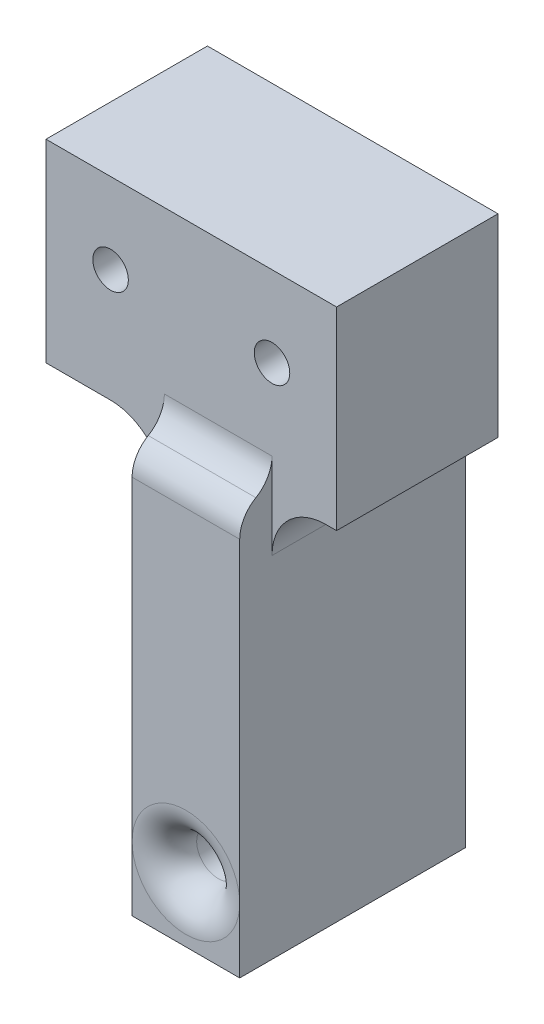
from build123d import *

# Parameters (mm, degrees)
SKETCH_2_R               = 1.65
EXTRUDE_1_DEPTH          = 15
SKETCH_4_W               = 10
SKETCH_4_H               = 21
EXTRUDE_2_DEPTH          = 37.5
CUT_EXTRUDE_1_DEPTH      = 54.011791141
CUT_EXTRUDE_1_DEPTH_BACK = 54.011791141
SKETCH_5_R               = 2
FILLET_1_R               = 3
FILLET_2_R               = 3
FILLET_3_R               = 5


with BuildPart() as part:
    # 草图2 → 凸台-拉伸1 (new body)
    with BuildSketch(Plane.XY):
        Polygon((-13.5, -7.5), (-13.5, 7.5), (13.5, 7.5), (13.5, -7.5), (13.5, -10.5), (-13.5, -10.5), align=None)
        with Locations((7.5, 0)):
            Circle(SKETCH_2_R, mode=Mode.SUBTRACT)
        with Locations((-7.5, 0)):
            Circle(SKETCH_2_R, mode=Mode.SUBTRACT)
    extrude(amount=EXTRUDE_1_DEPTH)

    # 草图4 → 凸台-拉伸2 (add)
    with BuildSketch(Plane.XZ.offset(10.5)):
        with Locations((2.5, 7.5)):
            Rectangle(SKETCH_4_W, SKETCH_4_H)
    extrude(amount=EXTRUDE_2_DEPTH)

    # 草图5 → 切除-拉伸1 (cut, two sides: drawn at the far end of the back side and taken through both)
    with BuildSketch(Plane(origin=(0, 0, 0), x_dir=(-1, 0, 0), z_dir=(0, 0, -1)).offset(-CUT_EXTRUDE_1_DEPTH_BACK)):
        with Locations((-2.5, -42)):
            Circle(SKETCH_5_R)
    extrude(amount=CUT_EXTRUDE_1_DEPTH + CUT_EXTRUDE_1_DEPTH_BACK, mode=Mode.SUBTRACT)

    # 圆角1
    fillet_1_edges = [part.edges().sort_by_distance(p)[0] for p in [
        (4.5, -42, 18),
        (2.5, -10.5, 0),
        (2.5, -10.5, 15),
        (4.5, -42, -3),
    ]]
    fillet(fillet_1_edges, radius=FILLET_1_R - 0.0001)  # a hair under: the kernel refuses the full size

    # 圆角2
    fillet_2_edges = [part.edges().sort_by_distance(p)[0] for p in [
        (2.5, -10.5, -3),
        (2.5, -10.5, 18),
    ]]
    fillet(fillet_2_edges, radius=FILLET_2_R)

    # 圆角3
    fillet_3_edges = [part.edges().sort_by_distance(p)[0] for p in [
        (7.5, -10.5, 7.5),
        (-2.5, -10.5, 7.5),
    ]]
    fillet(fillet_3_edges, radius=FILLET_3_R)


solid = part.part
